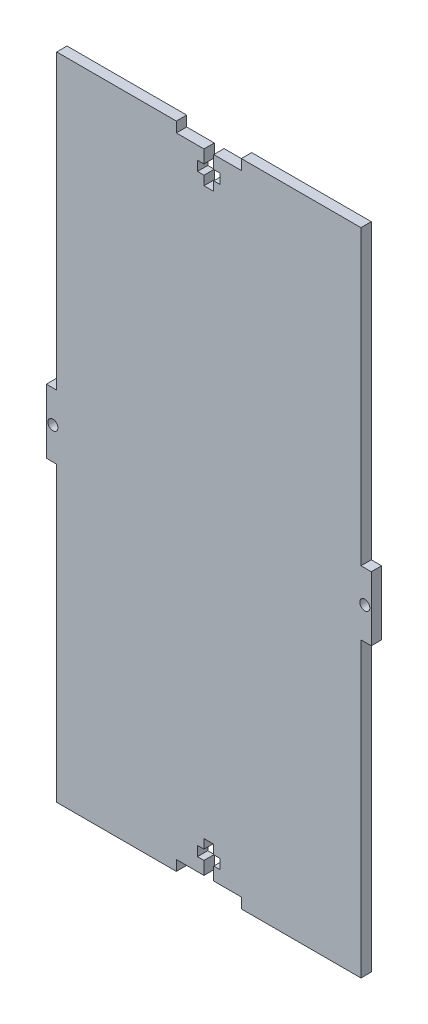
from build123d import *

# Parameters (mm, degrees)
SKETCH1_W           = 100
SKETCH1_H           = 200
BOSS_EXTRUDE2_DEPTH = 3.18
SKETCH2_R           = 1.55
SKETCH2_W           = 3.18
SKETCH2_H           = 90.125
CUT_EXTRUDE1_DEPTH  = 112.84861376


with BuildPart() as part:
    # Sketch1 → Boss-Extrude2 (new body)
    with BuildSketch(Plane.XY):
        Rectangle(SKETCH1_W, SKETCH1_H)
    extrude(amount=BOSS_EXTRUDE2_DEPTH)

    # Sketch2 → Cut-Extrude1 (cut, through all)
    with BuildSketch(Plane.XY.offset(3.18)):
        with Locations((-48, 0)):
            Circle(SKETCH2_R)
        Polygon((-10, 100), (-10, 96.82), (-1.5, 96.82), (-1.5, 92.82), (-3.5, 92.82), (-3.5, 89.82), (-1.5, 89.82), (-1.5, 87), (1.5, 87), (1.5, 89.82), (3.5, 89.82), (3.5, 92.82), (1.5, 92.82), (1.5, 96.82), (10, 96.82), (10, 100), align=None)
        with Locations((-48.41, 54.9375)):
            Rectangle(SKETCH2_W, SKETCH2_H)
        with Locations((-48.41, -54.9375)):
            Rectangle(SKETCH2_W, SKETCH2_H)
    cut_extrude1 = extrude(amount=-CUT_EXTRUDE1_DEPTH, mode=Mode.SUBTRACT)

    # Mirror1: Cut-Extrude1 across plane
    add(cut_extrude1.mirror(Plane.ZX), mode=Mode.SUBTRACT)

    # Mirror3: Cut-Extrude1 across plane
    add(cut_extrude1.mirror(Plane(origin=(0, 0, 0), x_dir=(0, 0, 1), z_dir=(1, 0, 0))), mode=Mode.SUBTRACT)


solid = part.part
